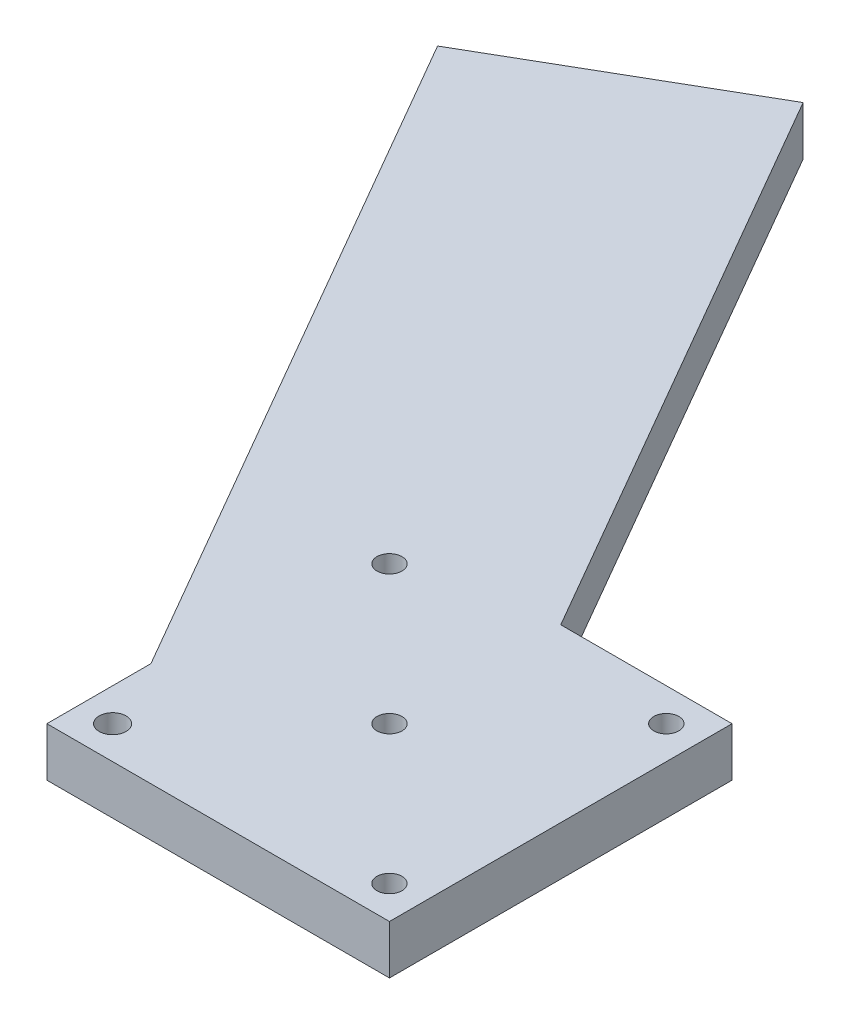
from build123d import *

# Parameters (mm, degrees)
SKETCH1_R           = 1.75
SKETCH1_R_2         = 1.625
BOSS_EXTRUDE1_DEPTH = 6.35


with BuildPart() as part:
    # Sketch1 → Boss-Extrude1 (new body)
    with BuildSketch(Plane(origin=(0, 0, 0), x_dir=(1, 0, 0), z_dir=(0, 1, 0))):
        Polygon((22.35631132, -22.09368868), (22.35631132, 22.35631132), (0.13131132, 22.35631132), (-42.824896411, 96.75864561), (-72.89368868, 79.3984203), (-22.09368868, -8.589760725), (-22.09368868, -22.09368868), align=None)
        with Locations((-17.829200922, -17.829200922)):
            Circle(SKETCH1_R, mode=Mode.SUBTRACT)
        with Locations((0.13131132, 0.13131132)):
            Circle(SKETCH1_R_2, mode=Mode.SUBTRACT)
        with Locations((18.091823562, 18.091823562)):
            Circle(SKETCH1_R_2, mode=Mode.SUBTRACT)
        with Locations((18.091823562, -17.829200922)):
            Circle(SKETCH1_R_2, mode=Mode.SUBTRACT)
        with Locations((-17.829200922, 18.091823562)):
            Circle(SKETCH1_R_2, mode=Mode.SUBTRACT)
    extrude(amount=BOSS_EXTRUDE1_DEPTH)


solid = part.part
